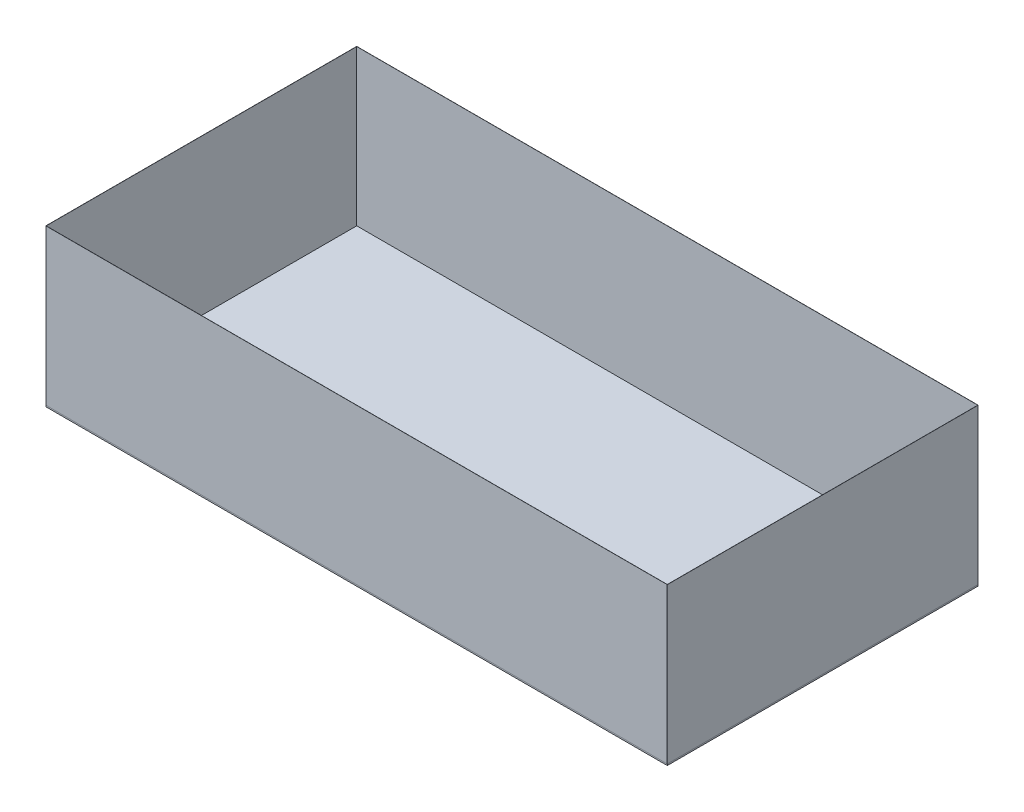
from build123d import *

# Parameters (mm, degrees)
SKETCH1_W     = 101.6
SKETCH1_H     = 50.8
FLOOR_2_DEPTH = 0.254
SKETCH2_W     = 101.6
SKETCH2_H     = 0.0254
WALL1_DEPTH   = 25.4
SKETCH3_W     = 0.0254
SKETCH3_H     = 50.8
WALL2_DEPTH   = 25.4
SKETCH4_W     = 101.6
SKETCH4_H     = 0.0254
WALL3_DEPTH   = 25.4
SKETCH5_W     = 0.0254
SKETCH5_H     = 50.8
WALL4_DEPTH   = 25.4


with BuildPart() as part:
    # Sketch1 → Floor 2 (new body)
    with BuildSketch(Plane(origin=(0, 0, 0), x_dir=(1, 0, 0), z_dir=(0, 1, 0))):
        with Locations((-24.703241895, -3.23042394)):
            Rectangle(SKETCH1_W, SKETCH1_H)
    extrude(amount=FLOOR_2_DEPTH)


with BuildPart() as body_2:
    # Sketch2 → Wall1 (new body)
    with BuildSketch(Plane(origin=(0, 0.254, 0), x_dir=(1, 0, 0), z_dir=(0, 1, 0))):
        with Locations((-24.703241895, 22.18227606)):
            Rectangle(SKETCH2_W, SKETCH2_H)
    extrude(amount=WALL1_DEPTH)


with BuildPart() as body_3:
    # Sketch3 → Wall2 (new body)
    with BuildSketch(Plane(origin=(0, 0.254, 0), x_dir=(1, 0, 0), z_dir=(0, 1, 0))):
        with Locations((-75.515941895, -3.23042394)):
            Rectangle(SKETCH3_W, SKETCH3_H)
    extrude(amount=WALL2_DEPTH)


with BuildPart() as body_4:
    # Sketch4 → Wall3 (new body)
    with BuildSketch(Plane(origin=(0, 0.254, 0), x_dir=(1, 0, 0), z_dir=(0, 1, 0))):
        with Locations((-24.703241895, -28.64312394)):
            Rectangle(SKETCH4_W, SKETCH4_H)
    extrude(amount=WALL3_DEPTH)


with BuildPart() as body_5:
    # Sketch5 → Wall4 (new body)
    with BuildSketch(Plane(origin=(0, 0.254, 0), x_dir=(1, 0, 0), z_dir=(0, 1, 0))):
        with Locations((26.109458105, -3.23042394)):
            Rectangle(SKETCH5_W, SKETCH5_H)
    extrude(amount=WALL4_DEPTH)


solid = Compound([part.part, body_2.part, body_3.part, body_4.part, body_5.part])
